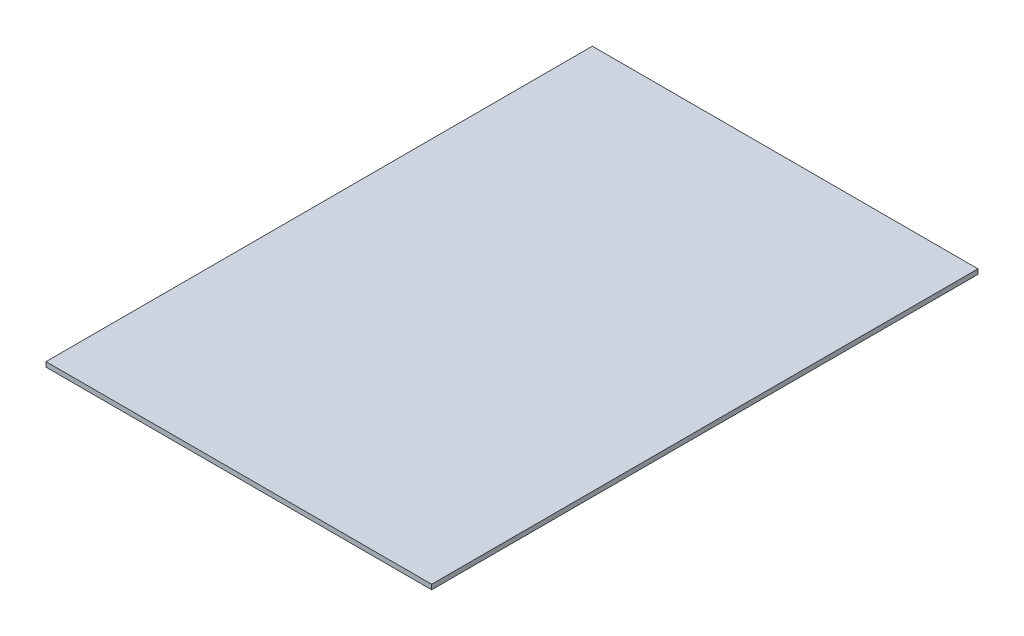
from build123d import *

# Parameters (mm, degrees)
SKETCH3_W           = 152.4
SKETCH3_H           = 215.9
BOSS_EXTRUDE2_DEPTH = 1.905


with BuildPart() as part:
    # Sketch3 → Boss-Extrude2 (new body)
    with BuildSketch(Plane(origin=(0, 0, 0), x_dir=(1, 0, 0), z_dir=(0, 1, 0))):
        with Locations((76.2, 107.95)):
            Rectangle(SKETCH3_W, SKETCH3_H)
    extrude(amount=BOSS_EXTRUDE2_DEPTH)


solid = part.part
